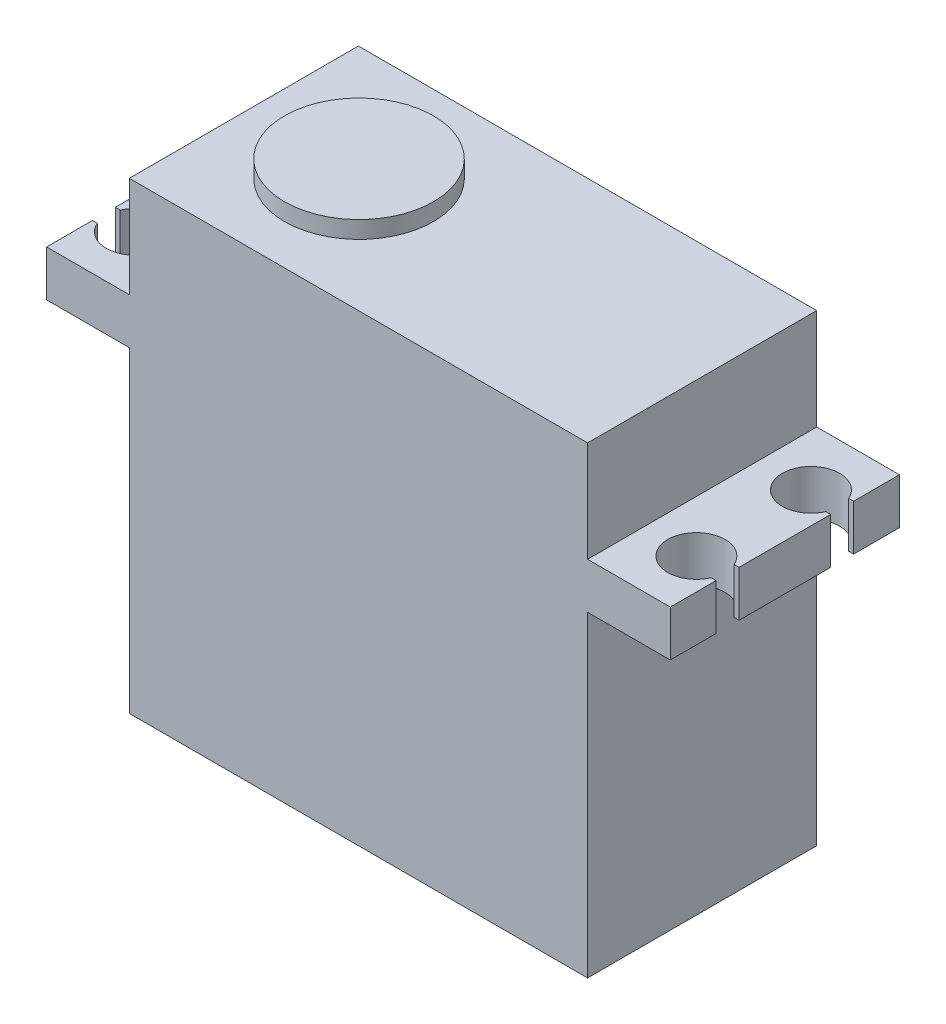
from build123d import *

# Parameters (mm, degrees)
SKETCH2_W             = 40
SKETCH2_H             = 20
BOSS_EXTRUDE1_DEPTH   = 27.65
SKETCH3_W             = 7
SKETCH3_H             = 4
BOSS_EXTRUDE2_DEPTH   = 5
SKETCH5_W             = 40
SKETCH5_H             = 20
BOSS_EXTRUDE5_DEPTH   = 12.8
SKETCH7_W             = 20
SKETCH7_H             = 4
BOSS_EXTRUDE6_DEPTH   = 7.22
CUT_EXTRUDE3_DEPTH    = 4
MIRROR11_COPY_1_DEPTH = 4
SKETCH9_R             = 6.5
BOSS_EXTRUDE8_DEPTH   = 1.5


with BuildPart() as part:
    # Sketch2 → Boss-Extrude1 (new body)
    with BuildSketch(Plane(origin=(0, 0, 0), x_dir=(1, 0, 0), z_dir=(0, 1, 0))):
        Rectangle(SKETCH2_W, SKETCH2_H)
    extrude(amount=BOSS_EXTRUDE1_DEPTH)

    # Sketch3 → Boss-Extrude2 (add)
    with BuildSketch(Plane.ZY.offset(20)):
        with Locations((0, 6)):
            Rectangle(SKETCH3_W, SKETCH3_H)
    extrude(amount=BOSS_EXTRUDE2_DEPTH)

    # Sketch5 → Boss-Extrude5 (add)
    with BuildSketch(Plane(origin=(0, 27.65, 0), x_dir=(1, 0, 0), z_dir=(0, 1, 0))):
        Rectangle(SKETCH5_W, SKETCH5_H)
    extrude(amount=BOSS_EXTRUDE5_DEPTH)

    # Sketch7 → Boss-Extrude6 (add)
    with BuildSketch(Plane.ZY.offset(20)):
        with Locations((0, 29.65)):
            Rectangle(SKETCH7_W, SKETCH7_H)
    boss_extrude6 = extrude(amount=BOSS_EXTRUDE6_DEPTH)

    # Sketch8 → Cut-Extrude3 (cut)
    with BuildSketch(Plane(origin=(0, 31.65, 0), x_dir=(1, 0, 0), z_dir=(0, 1, 0))):
        with BuildLine():
            Line((-27.22, 4), (-27.22, 6))
            Line((-27.22, 6), (-26.791287847, 6))
            ThreePointArc((-26.791287847, 6), (-22, 5), (-26.791287847, 4))
            Line((-26.791287847, 4), (-27.22, 4))
        make_face()
    cut_extrude3 = extrude(amount=-CUT_EXTRUDE3_DEPTH, mode=Mode.SUBTRACT)

    # Mirror10: Cut-Extrude3 across plane
    add(cut_extrude3.mirror(Plane.XY), mode=Mode.SUBTRACT)

    # Mirror11: Boss-Extrude6, Cut-Extrude3 across plane
    add(boss_extrude6.mirror(Plane(origin=(0, 0, 0), x_dir=(0, 0, 1), z_dir=(1, 0, 0))))
    add(cut_extrude3.mirror(Plane(origin=(0, 0, 0), x_dir=(0, 0, 1), z_dir=(1, 0, 0))), mode=Mode.SUBTRACT)

    # Mirror11 copy 1 sketch → Mirror11 copy 1 (cut)
    with BuildSketch(Plane(origin=(0, 31.65, 0), x_dir=(-1, 0, 0), z_dir=(0, 1, 0))):
        with BuildLine():
            Line((-27.22, 4), (-27.22, 6))
            Line((-27.22, 6), (-26.791287847, 6))
            ThreePointArc((-26.791287847, 6), (-22, 5), (-26.791287847, 4))
            Line((-26.791287847, 4), (-27.22, 4))
        make_face()
    extrude(amount=-MIRROR11_COPY_1_DEPTH, mode=Mode.SUBTRACT)

    # Sketch9 → Boss-Extrude8 (add)
    with BuildSketch(Plane(origin=(0, 40.45, 0), x_dir=(1, 0, 0), z_dir=(0, 1, 0))):
        with Locations((-9.95, 0)):
            Circle(SKETCH9_R)
    extrude(amount=BOSS_EXTRUDE8_DEPTH)


solid = part.part
